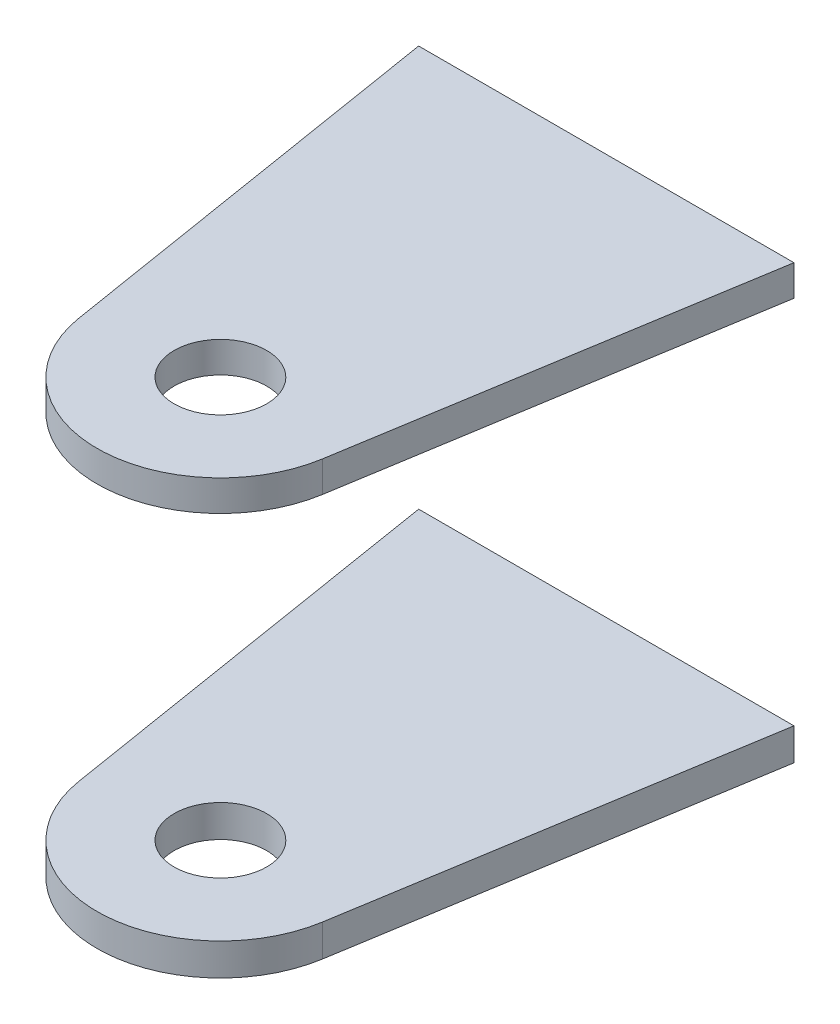
from build123d import *

# Parameters (mm, degrees)
BOSS_EXTRUDE3_START = 19.05
SKETCH4_R           = 4.7625
BOSS_EXTRUDE3_DEPTH = 3.175
BOSS_EXTRUDE4_START = -19.05
SKETCH4_3_R         = 4.7625
BOSS_EXTRUDE4_DEPTH = 3.302


with BuildPart() as part:
    # Sketch4 → Boss-Extrude3 (new body)
    with BuildSketch(Plane(origin=(0, 0, 0), x_dir=(1, 0, 0), z_dir=(0, 1, 0)).offset(BOSS_EXTRUDE3_START)):
        with BuildLine():
            ThreePointArc((-12.535957042, -2.034645188), (0, -12.7), (12.535957042, -2.034645188))
            Line((12.535957042, -2.034645188), (19.311560909, 39.711542072))
            Line((19.311560909, 39.711542072), (-19.311560909, 39.711542072))
            Line((-19.311560909, 39.711542072), (-12.535957042, -2.034645188))
        make_face()
        Circle(SKETCH4_R, mode=Mode.SUBTRACT)
    extrude(amount=BOSS_EXTRUDE3_DEPTH)


with BuildPart() as body_2:
    # Sketch4<3> → Boss-Extrude4 (new body)
    with BuildSketch(Plane(origin=(0, 0, 0), x_dir=(1, 0, 0), z_dir=(0, 1, 0)).offset(BOSS_EXTRUDE4_START)):
        with BuildLine():
            ThreePointArc((-12.535957042, -2.034645188), (0, -12.7), (12.535957042, -2.034645188))
            Line((12.535957042, -2.034645188), (19.311560909, 39.711542072))
            Line((19.311560909, 39.711542072), (-19.311560909, 39.711542072))
            Line((-19.311560909, 39.711542072), (-12.535957042, -2.034645188))
        make_face()
        Circle(SKETCH4_3_R, mode=Mode.SUBTRACT)
    extrude(amount=-BOSS_EXTRUDE4_DEPTH)


solid = Compound([part.part, body_2.part])
